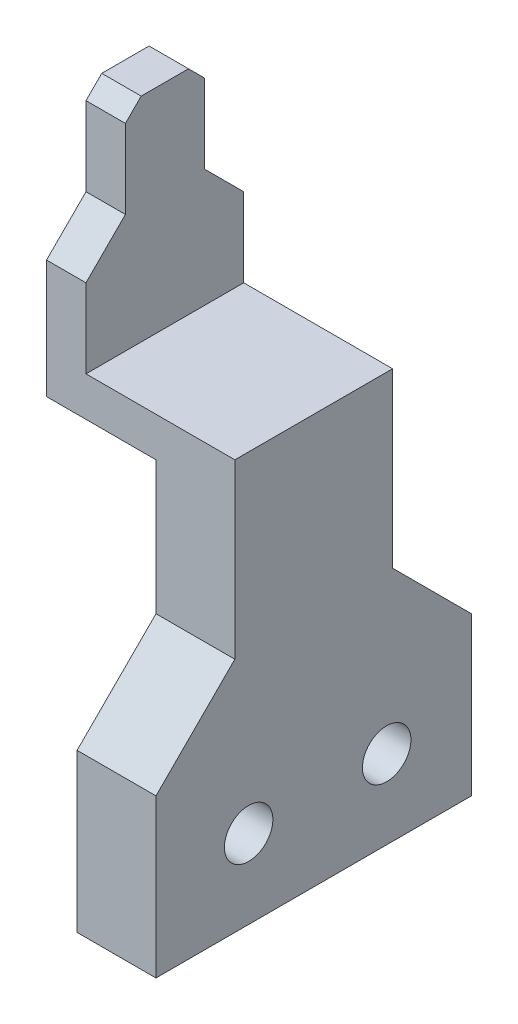
from build123d import *

# Parameters (mm, degrees)
SKETCH_1_W          = 40
SKETCH_1_H          = 20
EXTRUDE_1_DEPTH     = 10
SKETCH_2_R          = 3.07375
CUT_EXTRUDE_1_DEPTH = 10
EXTRUDE_2_DEPTH     = 40
CUT_EXTRUDE_2_DEPTH = 92.624619881
SKETCH_5_W          = 5
SKETCH_5_H          = 17
CUT_EXTRUDE_3_DEPTH = 91.450654881
CHAMFER_1_SIZE      = 5
CHAMFER_2_SIZE      = 2


with BuildPart() as part:
    # 草图1 → 凸台-拉伸1 (new body)
    with BuildSketch(Plane(origin=(0, 0, 0), x_dir=(0, 0, -1), z_dir=(1, 0, 0))):
        with Locations((20, 10)):
            Rectangle(SKETCH_1_W, SKETCH_1_H)
    extrude(amount=EXTRUDE_1_DEPTH)

    # 草图2 → 切除-拉伸1 (cut)
    with BuildSketch(Plane(origin=(10, 0, 0), x_dir=(0, 0, -1), z_dir=(1, 0, 0))):
        with Locations((11.75, 10)):
            Circle(SKETCH_2_R)
        with Locations((29.25, 10)):
            Circle(SKETCH_2_R)
    extrude(amount=-CUT_EXTRUDE_1_DEPTH, mode=Mode.SUBTRACT)

    # 草图3 → 凸台-拉伸2 (add)
    with BuildSketch(Plane(origin=(0, 0, -40), x_dir=(-1, 0, 0), z_dir=(0, 0, -1))):
        Polygon((0, 20), (0, 46.899019914), (13.875, 46.899019914), (13.875, 78.899019914), (8.875, 78.899019914), (8.875, 51.899019914), (-10, 51.899019914), (-10, 20), align=None)
    extrude(amount=-EXTRUDE_2_DEPTH)

    # 草图4 → 切除-拉伸2 (cut, through all)
    with BuildSketch(Plane(origin=(10, 0, 0), x_dir=(0, 0, -1), z_dir=(1, 0, 0))):
        Polygon((30, 30), (30, 88.448191602), (51.195528036, 88.448191602), (51.195528036, 8.804471964), align=None)
        Polygon((10, 30), (10, 90.801384447), (0, 90.801384447), (0, 20), align=None)
    extrude(amount=-CUT_EXTRUDE_2_DEPTH, mode=Mode.SUBTRACT)

    # 草图5 → 切除-拉伸3 (cut, through all)
    with BuildSketch(Plane(origin=(-8.875, 0, 0), x_dir=(0, 0, -1), z_dir=(1, 0, 0))):
        with Locations((12.5, 70.399019914)):
            Rectangle(SKETCH_5_W, SKETCH_5_H)
        with Locations((27.5, 70.399019914)):
            Rectangle(SKETCH_5_W, SKETCH_5_H)
    extrude(amount=-CUT_EXTRUDE_3_DEPTH, mode=Mode.SUBTRACT)

    # 倒角1
    chamfer_1_edges = [part.edges().sort_by_distance(p)[0] for p in [
        (-11.375, 61.899019914, -25),
        (-11.375, 61.899019914, -15),
    ]]
    chamfer(chamfer_1_edges, length=CHAMFER_1_SIZE - 0.0001)  # a hair under: the kernel refuses the full size

    # 倒角2
    chamfer_2_edges = [part.edges().sort_by_distance(p)[0] for p in [
        (-11.375, 78.899019914, -15),
        (-11.375, 78.899019914, -25),
    ]]
    chamfer(chamfer_2_edges, length=CHAMFER_2_SIZE)


solid = part.part
